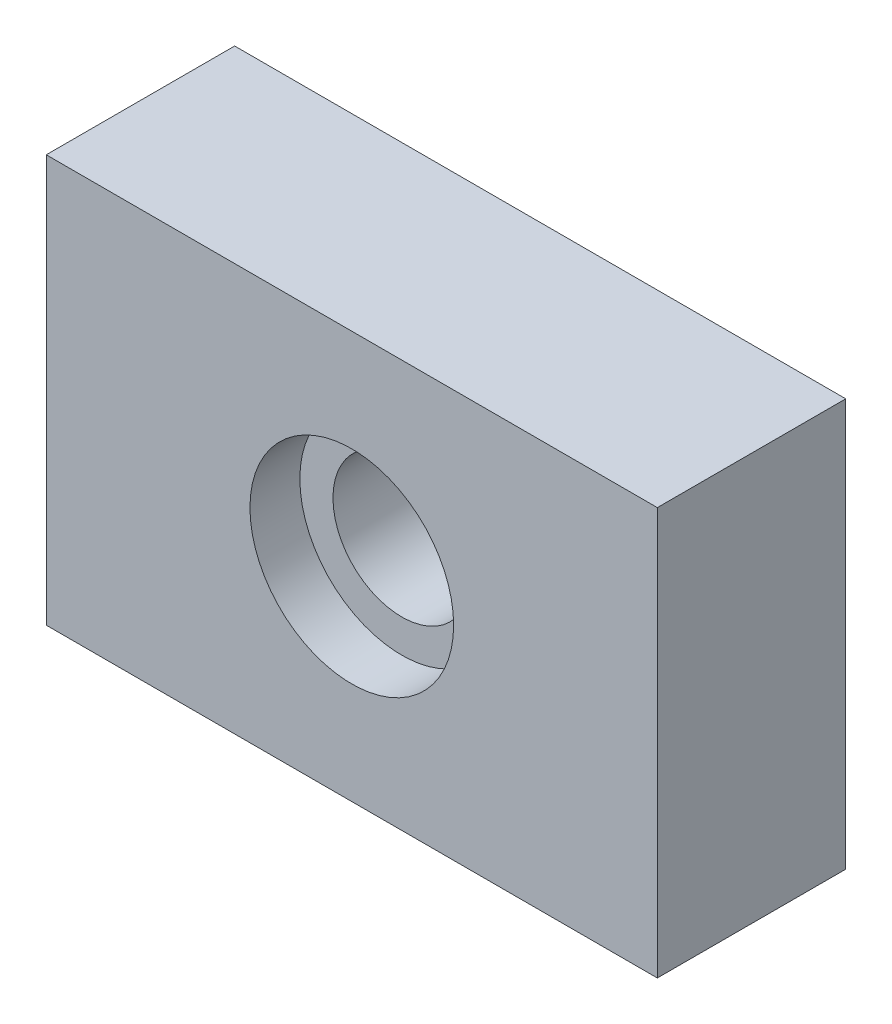
from build123d import *

# Parameters (mm, degrees)
SKETCH1_W                       = 152.4
SKETCH1_H                       = 101.6
BOSS_EXTRUDE1_DEPTH             = 46.99
SKETCH2_R                       = 17.145
CUT_EXTRUDE1_DEPTH              = 190.093574983
SKETCH2_2_R                     = 25.4
SKETCH2_2_R_2                   = 17.145
CUT_EXTRUDE3_DEPTH              = 12.446
TAP_DRILL_FOR_1_2_13_TAP1_D     = 10.71626
TAP_DRILL_FOR_1_2_13_TAP1_DEPTH = 19.05
TAP_DRILL_FOR_1_2_13_TAP1_TIP   = 3.219489309


with BuildPart() as part:
    # Sketch1 → Boss-Extrude1 (new body)
    with BuildSketch(Plane.XY):
        with Locations((76.2, 50.8)):
            Rectangle(SKETCH1_W, SKETCH1_H)
    extrude(amount=BOSS_EXTRUDE1_DEPTH)

    # Sketch2 → Cut-Extrude1 (cut, through all)
    with BuildSketch(Plane(origin=(0, 0, 0), x_dir=(-1, 0, 0), z_dir=(0, 0, -1))):
        with Locations((-76.2, 50.8)):
            Circle(SKETCH2_R)
    extrude(amount=-CUT_EXTRUDE1_DEPTH, mode=Mode.SUBTRACT)

    # Sketch2<2> → Cut-Extrude3 (cut)
    with BuildSketch(Plane(origin=(0, 0, 0), x_dir=(-1, 0, 0), z_dir=(0, 0, -1))):
        with Locations((-76.2, 50.8)):
            Circle(SKETCH2_2_R)
        with Locations((-76.2, 50.8)):
            Circle(SKETCH2_2_R_2, mode=Mode.SUBTRACT)
    cut_extrude3 = extrude(amount=-CUT_EXTRUDE3_DEPTH, mode=Mode.SUBTRACT)

    # Mirror2: Cut-Extrude3 across plane
    add(cut_extrude3.mirror(Plane(origin=(0, 0, 23.495), x_dir=(1, 0, 0), z_dir=(0, 0, -1))), mode=Mode.SUBTRACT)

    # Tap Drill for 1/2-13 Tap1
    with Locations(Plane(origin=(0, 0, 0), x_dir=(-1, 0, 0), z_dir=(0, -1, 0))):
        with Locations((-66.653283, -23.495), (-28.553283, -23.495)):
            Hole(TAP_DRILL_FOR_1_2_13_TAP1_D / 2, depth=TAP_DRILL_FOR_1_2_13_TAP1_DEPTH)
            with Locations((0, 0, -(TAP_DRILL_FOR_1_2_13_TAP1_DEPTH + TAP_DRILL_FOR_1_2_13_TAP1_TIP / 2))):  # 118° drill point
                Cone(0, TAP_DRILL_FOR_1_2_13_TAP1_D / 2, TAP_DRILL_FOR_1_2_13_TAP1_TIP, mode=Mode.SUBTRACT)


solid = part.part
